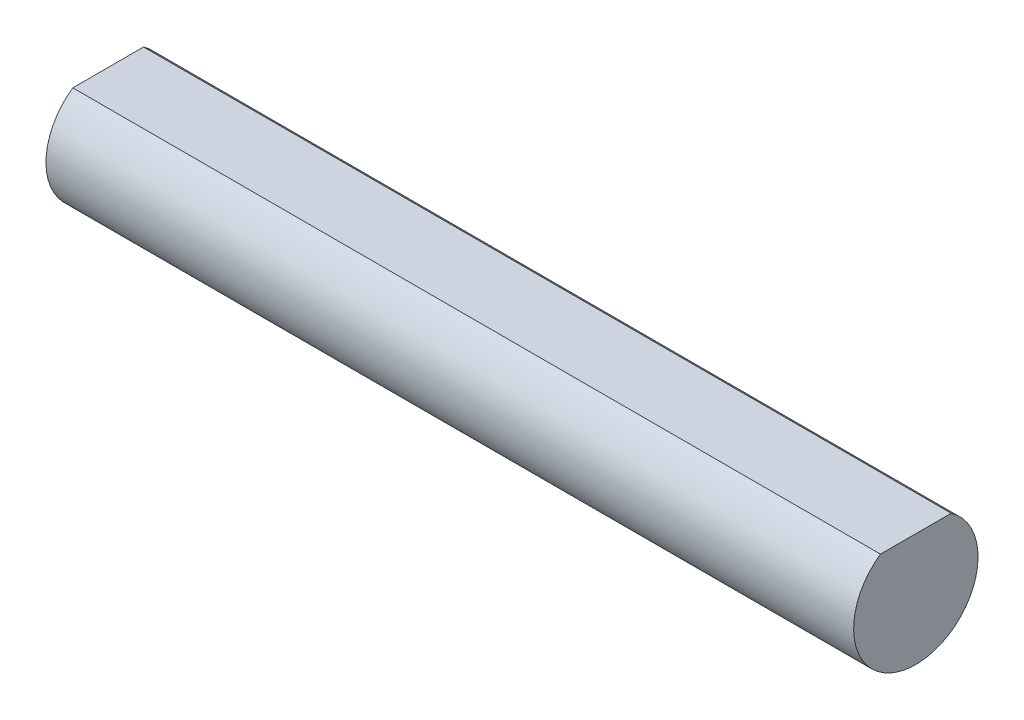
from build123d import *

# Parameters (mm, degrees)
BOSS_EXTRUDE1_DEPTH = 12.5


with BuildPart() as part:
    # Sketch1 → Boss-Extrude1 (new, symmetric)
    with BuildSketch(Plane(origin=(0, 0, 0), x_dir=(0, 0, -1), z_dir=(1, 0, 0))):
        with BuildLine():
            Line((1.095101338, 1.583154465), (-1.095101338, 1.583154465))
            ThreePointArc((-1.095101338, 1.583154465), (0, -1.925), (1.095101338, 1.583154465))
        make_face()
    extrude(amount=BOSS_EXTRUDE1_DEPTH, both=True)


solid = part.part
